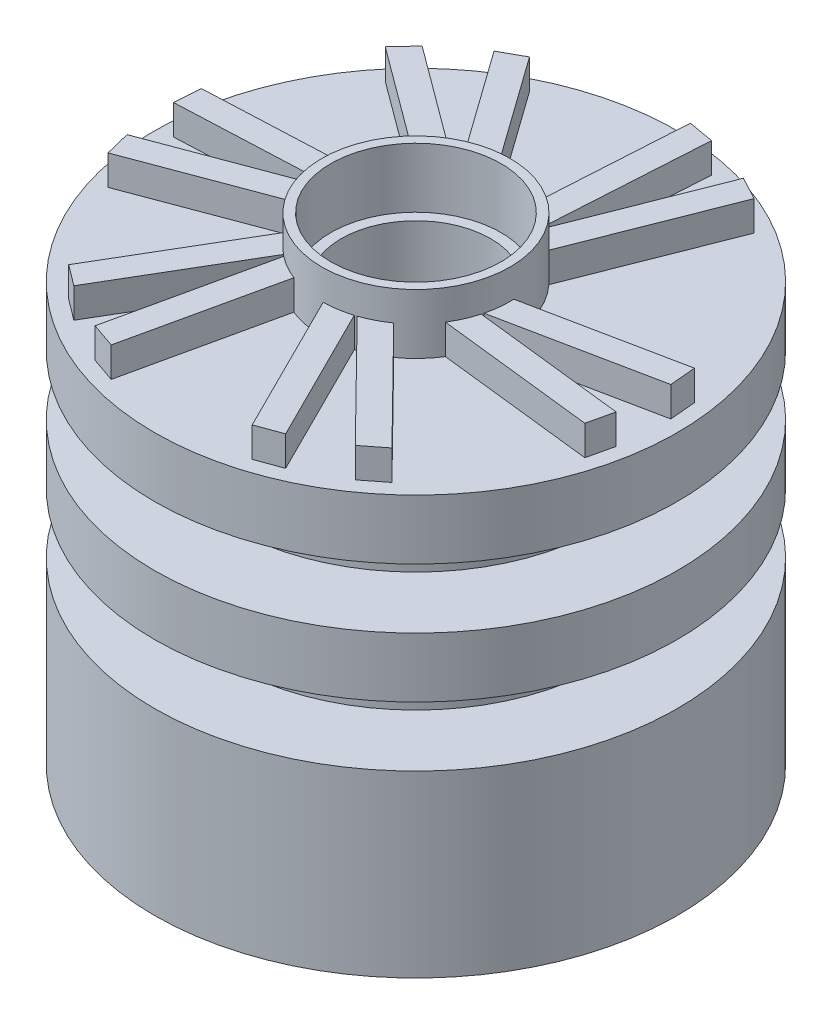
from build123d import *

# Parameters (mm, degrees)
SKETCH1_R            = 8.75
BOSS_EXTRUDE1_DEPTH  = 6
SKETCH2_R            = 8.25
SKETCH2_R_2          = 3.75
CUT_EXTRUDE1_DEPTH   = 5
SKETCH3_R            = 2.5
CUT_EXTRUDE2_DEPTH   = 20
BOSS_EXTRUDE3_START  = 1
SKETCH5_R            = 3.75
SKETCH5_R_2          = 2.5
BOSS_EXTRUDE3_DEPTH  = 1
SKETCH4_R            = 6.25
BOSS_EXTRUDE4_DEPTH  = 2
SKETCH7_R            = 8.75
BOSS_EXTRUDE5_DEPTH  = 2
SKETCH9_R            = 6.25
BOSS_EXTRUDE6_DEPTH  = 2
SKETCH10_R           = 8.75
BOSS_EXTRUDE7_DEPTH  = 2
SKETCH11_R           = 2.5
CUT_EXTRUDE4_DEPTH   = 15.735162028
SKETCH12_R           = 3.1
BOSS_EXTRUDE8_DEPTH  = 1
SKETCH13_R           = 3.065
CUT_EXTRUDE5_DEPTH   = 1
CUT_EXTRUDE6_START   = -1
SKETCH15_R           = 8.25
CUT_EXTRUDE6_DEPTH   = 1
SKETCH16_R           = 3.15
SKETCH16_R_2         = 2.85
BOSS_EXTRUDE10_DEPTH = 2
BOSS_EXTRUDE11_DEPTH = 1
CIRPATTERN1_START    = 14
CIRPATTERN1_DEPTH    = 1


# Read off the part's stored shape, not the designer's step: CirPattern1
with BuildPart() as part:
    # Sketch1 → Boss-Extrude1 (new body)
    with BuildSketch(Plane(origin=(0, 0, 0), x_dir=(1, 0, 0), z_dir=(0, 1, 0))):
        with Locations(Location((0, 0, 0), (0, 0, 270))):
            Circle(SKETCH1_R)
    extrude(amount=BOSS_EXTRUDE1_DEPTH)

    # Sketch2 → Cut-Extrude1 (cut)
    with BuildSketch(Plane.XZ):
        with Locations(Location((0, 0, 0), (0, 0, 270))):
            Circle(SKETCH2_R)
        with Locations(Location((0, 0, 0), (0, 0, 270))):
            Circle(SKETCH2_R_2, mode=Mode.SUBTRACT)
    extrude(amount=-CUT_EXTRUDE1_DEPTH, mode=Mode.SUBTRACT)

    # Sketch3 → Cut-Extrude2 (cut)
    with BuildSketch(Plane.XZ):
        with Locations(Location((0, 0, 0), (0, 0, 270))):
            Circle(SKETCH3_R)
    extrude(amount=-CUT_EXTRUDE2_DEPTH, mode=Mode.SUBTRACT)

    # Sketch5 → Boss-Extrude3 (add)
    with BuildSketch(Plane.XZ.offset(BOSS_EXTRUDE3_START)):
        with Locations(Location((0, 0, 0), (0, 0, 270))):
            Circle(SKETCH5_R)
        with Locations(Location((0, 0, 0), (0, 0, 270))):
            Circle(SKETCH5_R_2, mode=Mode.SUBTRACT)
    extrude(amount=-BOSS_EXTRUDE3_DEPTH)

    # Sketch4 → Boss-Extrude4 (add)
    with BuildSketch(Plane(origin=(0, 6, 0), x_dir=(1, 0, 0), z_dir=(0, 1, 0))):
        with Locations(Location((0, 0, 0), (0, 0, 270))):
            Circle(SKETCH4_R)
    extrude(amount=BOSS_EXTRUDE4_DEPTH)

    # Sketch7 → Boss-Extrude5 (add)
    with BuildSketch(Plane(origin=(0, 8, 0), x_dir=(1, 0, 0), z_dir=(0, 1, 0))):
        with Locations(Location((0, 0, 0), (0, 0, 270))):
            Circle(SKETCH7_R)
    extrude(amount=BOSS_EXTRUDE5_DEPTH)

    # Sketch9 → Boss-Extrude6 (add)
    with BuildSketch(Plane(origin=(0, 10, 0), x_dir=(1, 0, 0), z_dir=(0, 1, 0))):
        with Locations(Location((0, 0, 0), (0, 0, 270))):
            Circle(SKETCH9_R)
    extrude(amount=BOSS_EXTRUDE6_DEPTH)

    # Sketch10 → Boss-Extrude7 (add)
    with BuildSketch(Plane(origin=(0, 12, 0), x_dir=(1, 0, 0), z_dir=(0, 1, 0))):
        with Locations(Location((0, 0, 0), (0, 0, 270))):
            Circle(SKETCH10_R)
    extrude(amount=BOSS_EXTRUDE7_DEPTH)

    # Sketch11 → Cut-Extrude4 (cut, through all)
    with BuildSketch(Plane.XZ.offset(-6)):
        with Locations(Location((0, 0, 0), (0, 0, 270))):
            Circle(SKETCH11_R)
    extrude(amount=-CUT_EXTRUDE4_DEPTH, mode=Mode.SUBTRACT)

    # Sketch12 → Boss-Extrude8 (add)
    with BuildSketch(Plane(origin=(0, 14, 0), x_dir=(1, 0, 0), z_dir=(0, 1, 0))):
        with Locations(Location((0, 0, 0), (0, 0, 270))):
            Circle(SKETCH12_R)
    extrude(amount=BOSS_EXTRUDE8_DEPTH)

    # Sketch13 → Cut-Extrude5 (cut)
    with BuildSketch(Plane(origin=(0, 15, 0), x_dir=(1, 0, 0), z_dir=(0, 1, 0))):
        with Locations(Location((0, 0, 0), (0, 0, 270))):
            Circle(SKETCH13_R)
    extrude(amount=-CUT_EXTRUDE5_DEPTH, mode=Mode.SUBTRACT)

    # Sketch15 → Cut-Extrude6 (cut)
    with BuildSketch(Plane(origin=(0, 15, 0), x_dir=(1, 0, 0), z_dir=(0, 1, 0)).offset(CUT_EXTRUDE6_START)):
        with Locations(Location((0, 0, 0), (0, 0, 90))):
            Circle(SKETCH15_R)
    extrude(amount=CUT_EXTRUDE6_DEPTH, mode=Mode.SUBTRACT)

    # Sketch16 → Boss-Extrude10 (add)
    with BuildSketch(Plane(origin=(0, 14, 0), x_dir=(1, 0, 0), z_dir=(0, 1, 0))):
        with Locations(Location((0, 0, 0), (0, 0, 270))):
            Circle(SKETCH16_R)
        with Locations(Location((0, 0, 0), (0, 0, 270))):
            Circle(SKETCH16_R_2, mode=Mode.SUBTRACT)
    extrude(amount=BOSS_EXTRUDE10_DEPTH)

    # Sketch14 → Boss-Extrude11 (add)
    with BuildSketch(Plane(origin=(0, 14, 0), x_dir=(1, 0, 0), z_dir=(0, 1, 0))):
        Polygon((0.998161763, 8.189393939), (0.684499773, 3.023484755), (1.533676009, 2.694037472), (1.858150244, 8.038020756), align=None)
    extrude(amount=BOSS_EXTRUDE11_DEPTH)

    # CirPattern1 outline → CirPattern1 (add)
    with BuildSketch(Plane(origin=(0, 0, 0), x_dir=(1, 0, 0), z_dir=(0, 1, 0)).offset(CIRPATTERN1_START)):
        with BuildLine():
            Line((-6.324565807, 5.297392505), (-2.203633173, 2.2508889))
            ThreePointArc((-2.203633173, 2.2508889), (-1.85566188, 2.545391716), (-1.468825776, 2.786584081))
            Line((-1.468825776, 2.786584081), (-5.729230277, 5.936195788))
            Line((-5.729230277, 5.936195788), (-6.324565807, 5.297392505))
        make_face()
        with BuildLine():
            ThreePointArc((-3.129074903, 0.362477928), (-3.043987046, 0.810335032), (-2.895146203, 1.241220553))
            Line((-2.895146203, 1.241220553), (-8.188217227, 1.007769145))
            Line((-8.188217227, 1.007769145), (-8.248867898, 0.136668965))
            Line((-8.248867898, 0.136668965), (-3.129074903, 0.362477928))
        make_face()
        with BuildLine():
            Line((-4.378035213, 6.992517978), (-1.400216766, 2.821682656))
            ThreePointArc((-1.400216766, 2.821682656), (-0.978270026, 2.994242435), (-0.535834488, 3.104091075))
            Line((-0.535834488, 3.104091075), (-3.614436407, 7.416087207))
            Line((-3.614436407, 7.416087207), (-4.378035213, 6.992517978))
        make_face()
        with BuildLine():
            ThreePointArc((-3.087938917, -0.622200326), (-3.145411012, -0.169969315), (-3.137005907, 0.285821517))
            Line((-3.137005907, 0.285821517), (-8.098875142, -1.571852864))
            Line((-8.098875142, -1.571852864), (-7.887372599, -2.419060455))
            Line((-7.887372599, -2.419060455), (-3.087938917, -0.622200326))
        make_face()
        with BuildLine():
            Line((3.47997015, 7.480127523), (1.603849487, 2.711119109))
            ThreePointArc((1.603849487, 2.711119109), (1.97837896, 2.451227588), (2.311473446, 2.139997782))
            Line((2.311473446, 2.139997782), (4.251090913, 7.070412014))
            Line((4.251090913, 7.070412014), (3.47997015, 7.480127523))
        make_face()
        with BuildLine():
            ThreePointArc((-2.008215906, -2.426843397), (-2.337478309, -2.111562255), (-2.61778478, -1.752056747))
            Line((-2.61778478, -1.752056747), (-5.30480905, -6.318346377))
            Line((-5.30480905, -6.318346377), (-4.60727569, -6.843647471))
            Line((-4.60727569, -6.843647471), (-2.008215906, -2.426843397))
        make_face()
        with BuildLine():
            Line((8.168690382, 1.155420894), (3.14725484, 0.131479935))
            ThreePointArc((3.14725484, 0.131479935), (3.133274841, -0.324173978), (3.053671823, -0.773038421))
            Line((3.053671823, -0.773038421), (8.245056512, 0.285557547))
            Line((8.245056512, 0.285557547), (8.168690382, 1.155420894))
        make_face()
        with BuildLine():
            ThreePointArc((-1.159990971, -2.92863807), (-1.570565356, -2.730535563), (-1.948245964, -2.47524497))
            Line((-1.948245964, -2.47524497), (-3.092696808, -7.648380643))
            Line((-3.092696808, -7.648380643), (-2.266976195, -7.932422009))
            Line((-2.266976195, -7.932422009), (-1.159990971, -2.92863807))
        make_face()
        with BuildLine():
            Line((8.125930909, -1.42539358), (3.033846758, -0.847510382))
            ThreePointArc((3.033846758, -0.847510382), (2.879746187, -1.276542948), (2.665332476, -1.678839716))
            Line((2.665332476, -1.678839716), (7.929756858, -2.276281216))
            Line((7.929756858, -2.276281216), (8.125930909, -1.42539358))
        make_face()
        with BuildLine():
            ThreePointArc((0.941569357, -3.00598522), (0.497823185, -3.11041349), (0.04365065, -3.149697544))
            Line((0.04365065, -3.149697544), (2.409805062, -7.890205293))
            Line((2.409805062, -7.890205293), (3.230263526, -7.591304075))
            Line((3.230263526, -7.591304075), (0.941569357, -3.00598522))
        make_face()
        with BuildLine():
            Line((5.418005144, -6.221552882), (1.824386191, -2.567900899))
            ThreePointArc((1.824386191, -2.567900899), (1.434628612, -2.804343193), (1.014824303, -2.982051581))
            Line((1.014824303, -2.982051581), (4.730068332, -6.759360441))
            Line((4.730068332, -6.759360441), (5.418005144, -6.221552882))
        make_face()
    extrude(amount=CIRPATTERN1_DEPTH)


solid = part.part
